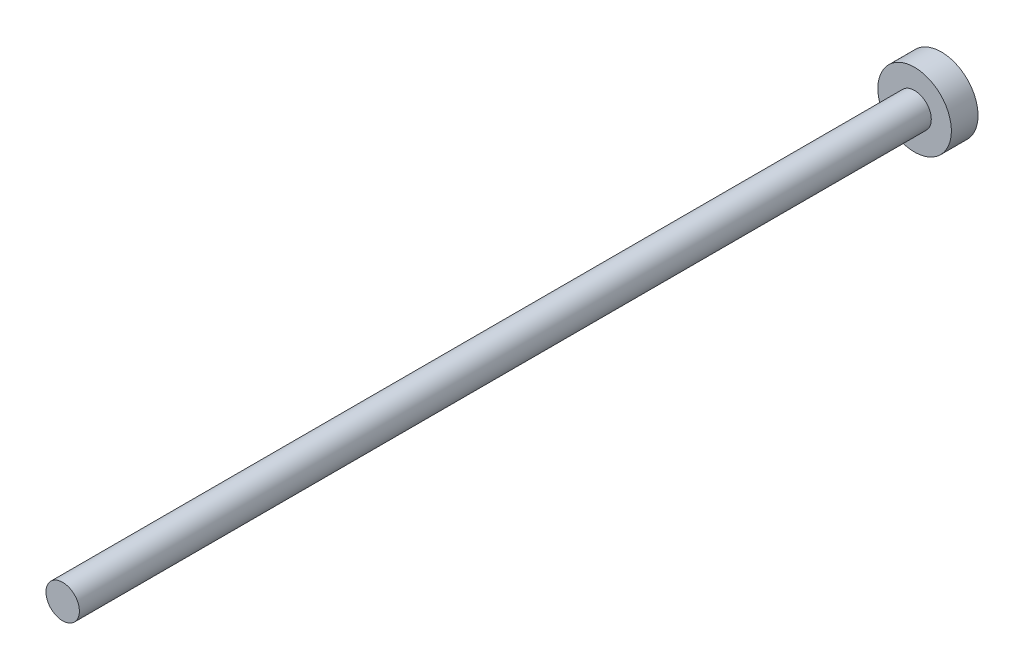
from build123d import *

# Parameters (mm, degrees)
SKETCH1_R           = 2.5
BOSS_EXTRUDE1_DEPTH = 63.75
SKETCH2_R           = 5.5
BOSS_EXTRUDE2_DEPTH = 4


with BuildPart() as part:
    # Sketch1 → Boss-Extrude1 (new, symmetric)
    with BuildSketch(Plane.XY):
        Circle(SKETCH1_R)
    extrude(amount=BOSS_EXTRUDE1_DEPTH, both=True)

    # Sketch2 → Boss-Extrude2 (add)
    with BuildSketch(Plane(origin=(0, 0, -63.75), x_dir=(-1, 0, 0), z_dir=(0, 0, -1))):
        Circle(SKETCH2_R)
    extrude(amount=BOSS_EXTRUDE2_DEPTH)


solid = part.part
